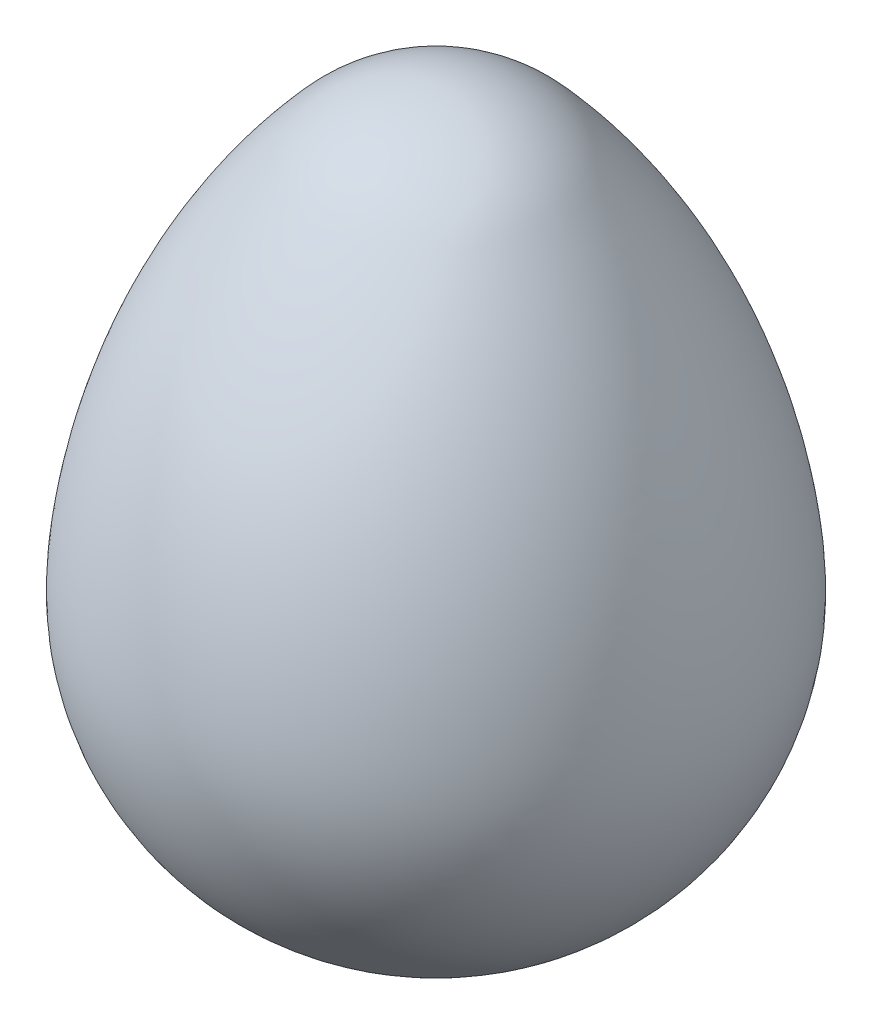
from build123d import *


with BuildPart() as part:
    # Sketch1 → Revolve1 (revolve)
    with BuildSketch(Plane.XY):
        with BuildLine():
            Line((0, 27.5), (0, -17.5))
            add(Edge.make_bspline(
                [(0, 27.5), (2.152962119, 27.5), (4.199258778, 26.830734832), (5.93612824, 25.558520087), (6.31428113, 25.281532268), (7.031813026, 24.674621246), (7.973142586, 23.609537782), (8.571840925, 22.887928952), (8.864757391, 22.52197567), (12.308404967, 18.219676958), (14.803155569, 13.305951053), (16.244330517, 7.986975812), (16.631767908, 6.557052338), (17.24776225, 3.654156775), (17.663268605, -0.992407443), (17.117497338, -3.928876909), (16.665458256, -5.339709835), (14.258826249, -12.850909224), (7.887331226, -17.5), (0, -17.5)],
                knots=[0, 0, 0, 0, 0.102843095, 0.102843095, 0.102843095, 0.12599901, 0.149154926, 0.172310841, 0.172310841, 0.172310841, 0.440733839, 0.440733839, 0.440733839, 0.513918775, 0.587103711, 0.660288648, 0.660288648, 0.660288648, 1, 1, 1, 1], degree=3, weights=[1, 0.966970944, 0.966970944, 1, 1, 1, 1, 1, 1, 0.986013474, 0.986013474, 1, 1, 1, 1, 1, 1, 0.871875868, 0.871875868, 1]))
        make_face()
    revolve(axis=Axis((0, 0, 0), (0, 1, 0)))


solid = part.part
